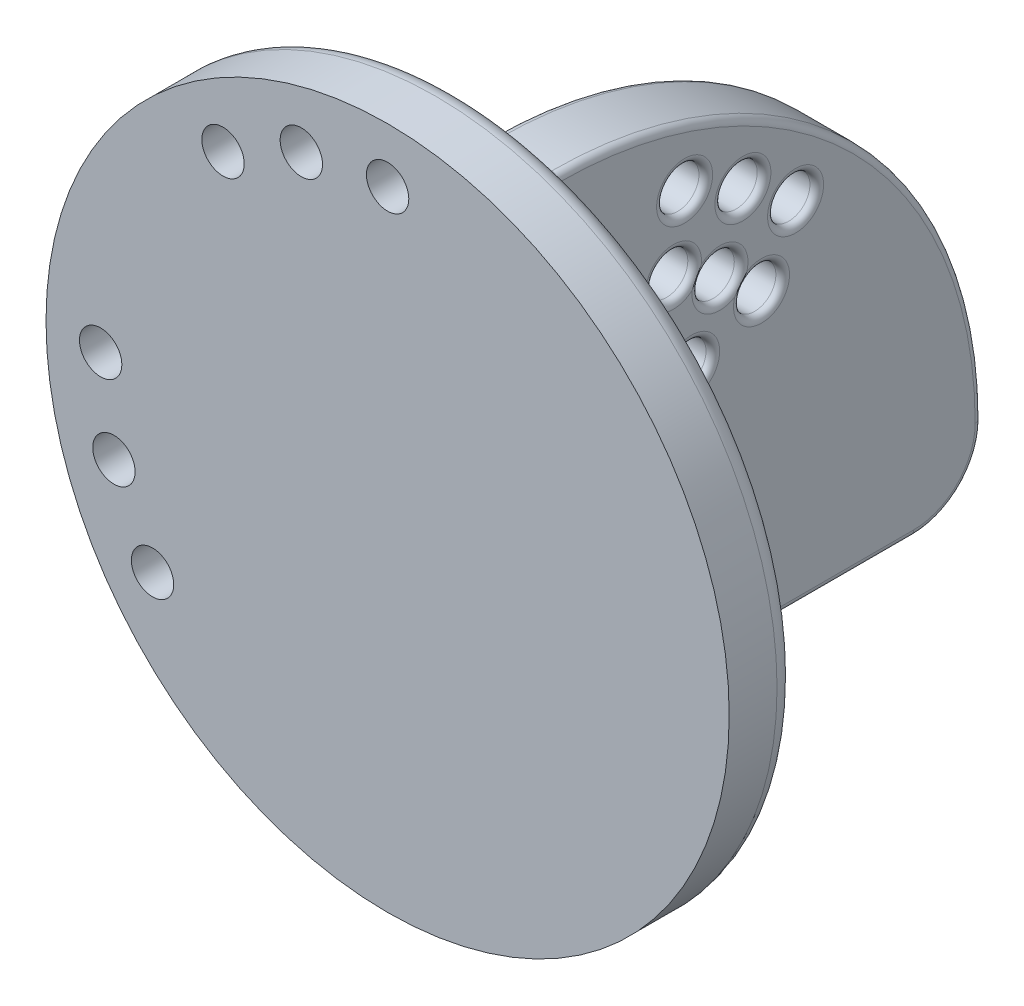
from build123d import *

# Parameters (mm, degrees)
SKETCH_1_R      = 25
SKETCH_1_R_2    = 1.55
EXTRUDE_1_DEPTH = 5
SKETCH_3_R      = 1.55
EXTRUDE_2_DEPTH = 2.5
FILLET_1_R      = 0.5
FILLET_2_R      = 1.5
FILLET_3_R      = 5


with BuildPart() as part:
    # ｽｹｯﾁ1 → ﾎﾞｽ - 押し出し1 (new body)
    with BuildSketch(Plane.XY):
        Circle(SKETCH_1_R)
        with Locations((0, 21)):
            Circle(SKETCH_1_R_2, mode=Mode.SUBTRACT)
        with Locations((-20.028055966, -6.31482179)):
            Circle(SKETCH_1_R_2, mode=Mode.SUBTRACT)
        with Locations((-6.31482179, 20.028055966)):
            Circle(SKETCH_1_R_2, mode=Mode.SUBTRACT)
        with Locations((-21, 0)):
            Circle(SKETCH_1_R_2, mode=Mode.SUBTRACT)
        with Locations((-17.20219293, -12.045105163)):
            Circle(SKETCH_1_R_2, mode=Mode.SUBTRACT)
        with Locations((-12.045105163, 17.20219293)):
            Circle(SKETCH_1_R_2, mode=Mode.SUBTRACT)
    extrude(amount=EXTRUDE_1_DEPTH)

    # ｽｹｯﾁ3 → ﾎﾞｽ - 押し出し2 (add, symmetric)
    with BuildSketch(Plane(origin=(0, 0, 0), x_dir=(0, 0, -1), z_dir=(1, 0, 0))):
        with BuildLine():
            Line((0, 18), (0, -18))
            Line((0, -18), (36, -18))
            Line((36, -18), (36, -13))
            ThreePointArc((36, -13), (26.920310217, 8.920310217), (5, 18))
            Line((5, 18), (0, 18))
        make_face()
        with Locations((5, -13)):
            Circle(SKETCH_3_R, mode=Mode.SUBTRACT)
        with Locations((18.5, 10.382685902)):
            Circle(SKETCH_3_R, mode=Mode.SUBTRACT)
        with Locations((12.305137148, -3.479759917)):
            Circle(SKETCH_3_R, mode=Mode.SUBTRACT)
        with Locations((14.750799418, 0.925584753)):
            Circle(SKETCH_3_R, mode=Mode.SUBTRACT)
        with Locations((13.419035512, 7.325349715)):
            Circle(SKETCH_3_R, mode=Mode.SUBTRACT)
        with Locations((16.820591384, 5.554611808)):
            Circle(SKETCH_3_R, mode=Mode.SUBTRACT)
        with Locations((14.23454387, 12.371700761)):
            Circle(SKETCH_3_R, mode=Mode.SUBTRACT)
        with Locations((19.862984568, 3.22010141)):
            Circle(SKETCH_3_R, mode=Mode.SUBTRACT)
        with Locations((22.355265462, 7.683199964)):
            Circle(SKETCH_3_R, mode=Mode.SUBTRACT)
    extrude(amount=EXTRUDE_2_DEPTH, both=True)

    # ﾌｨﾚｯﾄ1
    # the kernel refuses this fillet: 0.5 mm, written as the material it takes off along each edge
    with BuildSketch(Plane(origin=(-2.5, -18, 0), x_dir=(0, 1, 0), z_dir=(0, 0, -1)), Plane(origin=(2.5, -18, 0), x_dir=(-1, 0, 0), z_dir=(0, 0, -1))) as fillet_1_piece_1:
        with BuildLine():
            CenterArc((FILLET_1_R, FILLET_1_R), FILLET_1_R, 180, 90)
            Line((0, FILLET_1_R), (0, 0))
            Line((0, 0), (FILLET_1_R, 0))
        make_face()
    extrude(amount=37.25, mode=Mode.SUBTRACT)
    with BuildSketch(Plane(origin=(-2.5, -19.25, -36), x_dir=(0, 0, 1), z_dir=(0, 1, 0))) as fillet_1_piece_2:
        with BuildLine():
            CenterArc((FILLET_1_R, FILLET_1_R), FILLET_1_R, 180, 90)
            Line((0, FILLET_1_R), (0, 0))
            Line((0, 0), (FILLET_1_R, 0))
        make_face()
    extrude(amount=6.25, mode=Mode.SUBTRACT)
    with BuildSketch(Plane(origin=(2.5, -13, -5), x_dir=(0, 0, -1), z_dir=(0, -1, 0))) as fillet_1_piece_3:
        with BuildLine():
            CenterArc((31 - FILLET_1_R, -FILLET_1_R), FILLET_1_R, 0, 90)
            Line((31, -FILLET_1_R), (31, 0))
            Line((31, 0), (31 - FILLET_1_R, 0))
        make_face()
    revolve(axis=Axis((2.5, -13, -5), (1, 0, 0)), revolution_arc=90, mode=Mode.SUBTRACT)
    with BuildSketch(Plane(origin=(2.5, 10.382685902, -18.5), x_dir=(0, 0, -1), z_dir=(0, -1, 0))) as fillet_1_piece_4:
        with BuildLine():
            CenterArc((1.55 + FILLET_1_R, -FILLET_1_R), FILLET_1_R, 90, 90)
            Line((1.55, -FILLET_1_R), (1.55, 0))
            Line((1.55, 0), (1.55 + FILLET_1_R, 0))
        make_face()
    revolve(axis=Axis((2.5, 10.382685902, -18.5), (1, 0, 0)), mode=Mode.SUBTRACT)
    with BuildSketch(Plane(origin=(2.5, 7.683199964, -22.355265462), x_dir=(0, 0, -1), z_dir=(0, -1, 0))) as fillet_1_piece_5:
        with BuildLine():
            CenterArc((1.55 + FILLET_1_R, -FILLET_1_R), FILLET_1_R, 90, 90)
            Line((1.55, -FILLET_1_R), (1.55, 0))
            Line((1.55, 0), (1.55 + FILLET_1_R, 0))
        make_face()
    revolve(axis=Axis((2.5, 7.683199964, -22.355265462), (1, 0, 0)), mode=Mode.SUBTRACT)
    with BuildSketch(Plane(origin=(2.5, 12.371700761, -14.23454387), x_dir=(0, 0, -1), z_dir=(0, -1, 0))) as fillet_1_piece_6:
        with BuildLine():
            CenterArc((1.55 + FILLET_1_R, -FILLET_1_R), FILLET_1_R, 90, 90)
            Line((1.55, -FILLET_1_R), (1.55, 0))
            Line((1.55, 0), (1.55 + FILLET_1_R, 0))
        make_face()
    revolve(axis=Axis((2.5, 12.371700761, -14.23454387), (1, 0, 0)), mode=Mode.SUBTRACT)
    with BuildSketch(Plane(origin=(2.5, 5.554611808, -16.820591384), x_dir=(0, 0, -1), z_dir=(0, -1, 0))) as fillet_1_piece_7:
        with BuildLine():
            CenterArc((1.55 + FILLET_1_R, -FILLET_1_R), FILLET_1_R, 90, 90)
            Line((1.55, -FILLET_1_R), (1.55, 0))
            Line((1.55, 0), (1.55 + FILLET_1_R, 0))
        make_face()
    revolve(axis=Axis((2.5, 5.554611808, -16.820591384), (1, 0, 0)), mode=Mode.SUBTRACT)
    with BuildSketch(Plane(origin=(2.5, 3.22010141, -19.862984568), x_dir=(0, 0, -1), z_dir=(0, -1, 0))) as fillet_1_piece_8:
        with BuildLine():
            CenterArc((1.55 + FILLET_1_R, -FILLET_1_R), FILLET_1_R, 90, 90)
            Line((1.55, -FILLET_1_R), (1.55, 0))
            Line((1.55, 0), (1.55 + FILLET_1_R, 0))
        make_face()
    revolve(axis=Axis((2.5, 3.22010141, -19.862984568), (1, 0, 0)), mode=Mode.SUBTRACT)
    with BuildSketch(Plane(origin=(2.5, 0.925584753, -14.750799418), x_dir=(0, 0, -1), z_dir=(0, -1, 0))) as fillet_1_piece_9:
        with BuildLine():
            CenterArc((1.55 + FILLET_1_R, -FILLET_1_R), FILLET_1_R, 90, 90)
            Line((1.55, -FILLET_1_R), (1.55, 0))
            Line((1.55, 0), (1.55 + FILLET_1_R, 0))
        make_face()
    revolve(axis=Axis((2.5, 0.925584753, -14.750799418), (1, 0, 0)), mode=Mode.SUBTRACT)
    with BuildSketch(Plane(origin=(2.5, 7.325349715, -13.419035512), x_dir=(0, 0, -1), z_dir=(0, -1, 0))) as fillet_1_piece_10:
        with BuildLine():
            CenterArc((1.55 + FILLET_1_R, -FILLET_1_R), FILLET_1_R, 90, 90)
            Line((1.55, -FILLET_1_R), (1.55, 0))
            Line((1.55, 0), (1.55 + FILLET_1_R, 0))
        make_face()
    revolve(axis=Axis((2.5, 7.325349715, -13.419035512), (1, 0, 0)), mode=Mode.SUBTRACT)
    with BuildSketch(Plane(origin=(2.5, -3.479759917, -12.305137148), x_dir=(0, 0, -1), z_dir=(0, -1, 0))) as fillet_1_piece_11:
        with BuildLine():
            CenterArc((1.55 + FILLET_1_R, -FILLET_1_R), FILLET_1_R, 90, 90)
            Line((1.55, -FILLET_1_R), (1.55, 0))
            Line((1.55, 0), (1.55 + FILLET_1_R, 0))
        make_face()
    revolve(axis=Axis((2.5, -3.479759917, -12.305137148), (1, 0, 0)), mode=Mode.SUBTRACT)
    with BuildSketch(Plane(origin=(2.5, 18, -5), x_dir=(0, -1, 0), z_dir=(0, 0, 1))) as fillet_1_piece_12:
        with BuildLine():
            CenterArc((FILLET_1_R, -FILLET_1_R), FILLET_1_R, 90, 90)
            Line((0, -FILLET_1_R), (0, 0))
            Line((0, 0), (FILLET_1_R, 0))
        make_face()
    extrude(amount=5, mode=Mode.SUBTRACT)
    with BuildSketch(Plane(origin=(2.5, -13, -5), x_dir=(0, 0, -1), z_dir=(0, -1, 0))) as fillet_1_piece_13:
        with BuildLine():
            CenterArc((1.55 + FILLET_1_R, -FILLET_1_R), FILLET_1_R, 90, 90)
            Line((1.55, -FILLET_1_R), (1.55, 0))
            Line((1.55, 0), (1.55 + FILLET_1_R, 0))
        make_face()
    revolve(axis=Axis((2.5, -13, -5), (1, 0, 0)), mode=Mode.SUBTRACT)
    with BuildSketch(Plane(origin=(2.5, -19.25, -36), x_dir=(0, 0, 1), z_dir=(0, 1, 0))) as fillet_1_piece_14:
        with BuildLine():
            CenterArc((FILLET_1_R, -FILLET_1_R), FILLET_1_R, 90, 90)
            Line((0, -FILLET_1_R), (0, 0))
            Line((0, 0), (FILLET_1_R, 0))
        make_face()
    extrude(amount=6.25, mode=Mode.SUBTRACT)
    with BuildSketch(Plane(origin=(-2.5, 18, -5), x_dir=(0, -1, 0), z_dir=(0, 0, 1))) as fillet_1_piece_15:
        with BuildLine():
            CenterArc((FILLET_1_R, FILLET_1_R), FILLET_1_R, 180, 90)
            Line((0, FILLET_1_R), (0, 0))
            Line((0, 0), (FILLET_1_R, 0))
        make_face()
    extrude(amount=5, mode=Mode.SUBTRACT)
    with BuildSketch(Plane(origin=(-2.5, -13, -5), x_dir=(0, 0, -1), z_dir=(0, -1, 0))) as fillet_1_piece_16:
        with BuildLine():
            CenterArc((31 - FILLET_1_R, FILLET_1_R), FILLET_1_R, 270, 90)
            Line((31, FILLET_1_R), (31, 0))
            Line((31, 0), (31 - FILLET_1_R, 0))
        make_face()
    revolve(axis=Axis((-2.5, -13, -5), (1, 0, 0)), revolution_arc=90, mode=Mode.SUBTRACT)
    with BuildSketch(Plane(origin=(-2.5, -3.479759917, -12.305137148), x_dir=(0, 0, -1), z_dir=(0, -1, 0))) as fillet_1_piece_17:
        with BuildLine():
            CenterArc((1.55 + FILLET_1_R, FILLET_1_R), FILLET_1_R, 180, 90)
            Line((1.55, FILLET_1_R), (1.55, 0))
            Line((1.55, 0), (1.55 + FILLET_1_R, 0))
        make_face()
    revolve(axis=Axis((-2.5, -3.479759917, -12.305137148), (1, 0, 0)), mode=Mode.SUBTRACT)
    with BuildSketch(Plane(origin=(-2.5, 7.325349715, -13.419035512), x_dir=(0, 0, -1), z_dir=(0, -1, 0))) as fillet_1_piece_18:
        with BuildLine():
            CenterArc((1.55 + FILLET_1_R, FILLET_1_R), FILLET_1_R, 180, 90)
            Line((1.55, FILLET_1_R), (1.55, 0))
            Line((1.55, 0), (1.55 + FILLET_1_R, 0))
        make_face()
    revolve(axis=Axis((-2.5, 7.325349715, -13.419035512), (1, 0, 0)), mode=Mode.SUBTRACT)
    with BuildSketch(Plane(origin=(-2.5, 0.925584753, -14.750799418), x_dir=(0, 0, -1), z_dir=(0, -1, 0))) as fillet_1_piece_19:
        with BuildLine():
            CenterArc((1.55 + FILLET_1_R, FILLET_1_R), FILLET_1_R, 180, 90)
            Line((1.55, FILLET_1_R), (1.55, 0))
            Line((1.55, 0), (1.55 + FILLET_1_R, 0))
        make_face()
    revolve(axis=Axis((-2.5, 0.925584753, -14.750799418), (1, 0, 0)), mode=Mode.SUBTRACT)
    with BuildSketch(Plane(origin=(-2.5, 3.22010141, -19.862984568), x_dir=(0, 0, -1), z_dir=(0, -1, 0))) as fillet_1_piece_20:
        with BuildLine():
            CenterArc((1.55 + FILLET_1_R, FILLET_1_R), FILLET_1_R, 180, 90)
            Line((1.55, FILLET_1_R), (1.55, 0))
            Line((1.55, 0), (1.55 + FILLET_1_R, 0))
        make_face()
    revolve(axis=Axis((-2.5, 3.22010141, -19.862984568), (1, 0, 0)), mode=Mode.SUBTRACT)
    with BuildSketch(Plane(origin=(-2.5, 5.554611808, -16.820591384), x_dir=(0, 0, -1), z_dir=(0, -1, 0))) as fillet_1_piece_21:
        with BuildLine():
            CenterArc((1.55 + FILLET_1_R, FILLET_1_R), FILLET_1_R, 180, 90)
            Line((1.55, FILLET_1_R), (1.55, 0))
            Line((1.55, 0), (1.55 + FILLET_1_R, 0))
        make_face()
    revolve(axis=Axis((-2.5, 5.554611808, -16.820591384), (1, 0, 0)), mode=Mode.SUBTRACT)
    with BuildSketch(Plane(origin=(-2.5, 12.371700761, -14.23454387), x_dir=(0, 0, -1), z_dir=(0, -1, 0))) as fillet_1_piece_22:
        with BuildLine():
            CenterArc((1.55 + FILLET_1_R, FILLET_1_R), FILLET_1_R, 180, 90)
            Line((1.55, FILLET_1_R), (1.55, 0))
            Line((1.55, 0), (1.55 + FILLET_1_R, 0))
        make_face()
    revolve(axis=Axis((-2.5, 12.371700761, -14.23454387), (1, 0, 0)), mode=Mode.SUBTRACT)
    with BuildSketch(Plane(origin=(-2.5, 7.683199964, -22.355265462), x_dir=(0, 0, -1), z_dir=(0, -1, 0))) as fillet_1_piece_23:
        with BuildLine():
            CenterArc((1.55 + FILLET_1_R, FILLET_1_R), FILLET_1_R, 180, 90)
            Line((1.55, FILLET_1_R), (1.55, 0))
            Line((1.55, 0), (1.55 + FILLET_1_R, 0))
        make_face()
    revolve(axis=Axis((-2.5, 7.683199964, -22.355265462), (1, 0, 0)), mode=Mode.SUBTRACT)
    with BuildSketch(Plane(origin=(-2.5, 10.382685902, -18.5), x_dir=(0, 0, -1), z_dir=(0, -1, 0))) as fillet_1_piece_24:
        with BuildLine():
            CenterArc((1.55 + FILLET_1_R, FILLET_1_R), FILLET_1_R, 180, 90)
            Line((1.55, FILLET_1_R), (1.55, 0))
            Line((1.55, 0), (1.55 + FILLET_1_R, 0))
        make_face()
    revolve(axis=Axis((-2.5, 10.382685902, -18.5), (1, 0, 0)), mode=Mode.SUBTRACT)
    with BuildSketch(Plane(origin=(-2.5, -13, -5), x_dir=(0, 0, -1), z_dir=(0, -1, 0))) as fillet_1_piece_25:
        with BuildLine():
            CenterArc((1.55 + FILLET_1_R, FILLET_1_R), FILLET_1_R, 180, 90)
            Line((1.55, FILLET_1_R), (1.55, 0))
            Line((1.55, 0), (1.55 + FILLET_1_R, 0))
        make_face()
    revolve(axis=Axis((-2.5, -13, -5), (1, 0, 0)), mode=Mode.SUBTRACT)
    # the kernel refuses this fillet: 0.5 mm, written as the material it adds along each edge
    with BuildSketch(Plane(origin=(2.5, 17.5, 0), x_dir=(1, 0, 0), z_dir=(0, -1, 0))) as fillet_1_2_piece_1:
        with BuildLine():
            CenterArc((FILLET_1_R, -FILLET_1_R), FILLET_1_R, 90, 90)
            Line((0, -FILLET_1_R), (0, 0))
            Line((0, 0), (FILLET_1_R, 0))
        make_face()
    extrude(amount=35)
    with BuildSketch(Plane(origin=(-2, 18, 0), x_dir=(0, 1, 0), z_dir=(1, 0, 0))) as fillet_1_2_piece_2:
        with BuildLine():
            CenterArc((FILLET_1_R, -FILLET_1_R), FILLET_1_R, 90, 90)
            Line((0, -FILLET_1_R), (0, 0))
            Line((0, 0), (FILLET_1_R, 0))
        make_face()
    extrude(amount=4)
    with BuildSketch(Plane(origin=(-2, -18, 0), x_dir=(0, -1, 0), z_dir=(1, 0, 0))) as fillet_1_2_piece_3:
        with BuildLine():
            CenterArc((FILLET_1_R, FILLET_1_R), FILLET_1_R, 180, 90)
            Line((0, FILLET_1_R), (0, 0))
            Line((0, 0), (FILLET_1_R, 0))
        make_face()
    extrude(amount=4)
    with BuildSketch(Plane(origin=(-2.5, 17.5, 0), x_dir=(-1, 0, 0), z_dir=(0, -1, 0))) as fillet_1_2_piece_4:
        with BuildLine():
            CenterArc((FILLET_1_R, FILLET_1_R), FILLET_1_R, 180, 90)
            Line((0, FILLET_1_R), (0, 0))
            Line((0, 0), (FILLET_1_R, 0))
        make_face()
    extrude(amount=35)
    with BuildSketch(Plane(origin=(-2, 17.5, 0), x_dir=(-1, 0, 0), z_dir=(0, -1, 0))) as fillet_1_2_piece_5:
        with BuildLine():
            CenterArc((0.5 + FILLET_1_R, FILLET_1_R), FILLET_1_R, 180, 90)
            Line((0.5, FILLET_1_R), (0.5, 0))
            Line((0.5, 0), (0.5 + FILLET_1_R, 0))
        make_face()
    revolve(axis=Axis((-2, 17.5, 0), (0, 0, -1)), revolution_arc=90)
    with BuildSketch(Plane(origin=(-2, -17.5, 0), x_dir=(-1, 0, 0), z_dir=(0, 1, 0))) as fillet_1_2_piece_6:
        with BuildLine():
            CenterArc((0.5 + FILLET_1_R, -FILLET_1_R), FILLET_1_R, 90, 90)
            Line((0.5, -FILLET_1_R), (0.5, 0))
            Line((0.5, 0), (0.5 + FILLET_1_R, 0))
        make_face()
    revolve(axis=Axis((-2, -17.5, 0), (0, 0, 1)), revolution_arc=90)
    with BuildSketch(Plane(origin=(2, -17.5, 0), x_dir=(0, -1, 0), z_dir=(-1, 0, 0))) as fillet_1_2_piece_7:
        with BuildLine():
            CenterArc((0.5 + FILLET_1_R, -FILLET_1_R), FILLET_1_R, 90, 90)
            Line((0.5, -FILLET_1_R), (0.5, 0))
            Line((0.5, 0), (0.5 + FILLET_1_R, 0))
        make_face()
    revolve(axis=Axis((2, -17.5, 0), (0, 0, 1)), revolution_arc=90)
    with BuildSketch(Plane(origin=(2, 17.5, 0), x_dir=(1, 0, 0), z_dir=(0, -1, 0))) as fillet_1_2_piece_8:
        with BuildLine():
            CenterArc((0.5 + FILLET_1_R, -FILLET_1_R), FILLET_1_R, 90, 90)
            Line((0.5, -FILLET_1_R), (0.5, 0))
            Line((0.5, 0), (0.5 + FILLET_1_R, 0))
        make_face()
    revolve(axis=Axis((2, 17.5, 0), (0, 0, 1)), revolution_arc=90)

    # ﾌｨﾚｯﾄ2
    fillet_2_edges = [part.edges().sort_by_distance(p)[0] for p in [
        (-25, 0, 0),
    ]]
    fillet(fillet_2_edges, radius=FILLET_2_R)

    # ﾌｨﾚｯﾄ3
    # the kernel refuses this fillet: 5 mm, written as the material it takes off along each edge
    with BuildSketch(Plane(origin=(-2.5, -13, -31), x_dir=(0, 0, -1), z_dir=(0, 1, 0))) as fillet_3_piece_1:
        with BuildLine():
            CenterArc((4.5, -0.5), 0.5, 0, 90)
            Line((5, -0.5), (5, 0))
            Line((5, 0), (4.5, 0))
        make_face()
    revolve(axis=Axis((-2.5, -13, -31), (-1, 0, 0)), revolution_arc=90, mode=Mode.SUBTRACT)
    with BuildSketch(Plane(origin=(2.5, -13, -31), x_dir=(0, -1, 0), z_dir=(0, 0, 1))) as fillet_3_piece_2:
        with BuildLine():
            CenterArc((4.5, -0.5), 0.5, 0, 90)
            Line((5, -0.5), (5, 0))
            Line((5, 0), (4.5, 0))
        make_face()
    revolve(axis=Axis((2.5, -13, -31), (1, 0, 0)), revolution_arc=90, mode=Mode.SUBTRACT)
    with BuildSketch(Plane(origin=(2.5, -18, -36), x_dir=(0, 0, 1), z_dir=(-1, 0, 0))) as fillet_3_piece_3:
        with BuildLine():
            CenterArc((FILLET_3_R, FILLET_3_R), FILLET_3_R, 180, 90)
            Line((0, FILLET_3_R), (0, 0))
            Line((0, 0), (FILLET_3_R, 0))
        make_face()
    extrude(amount=5, mode=Mode.SUBTRACT)


solid = part.part
